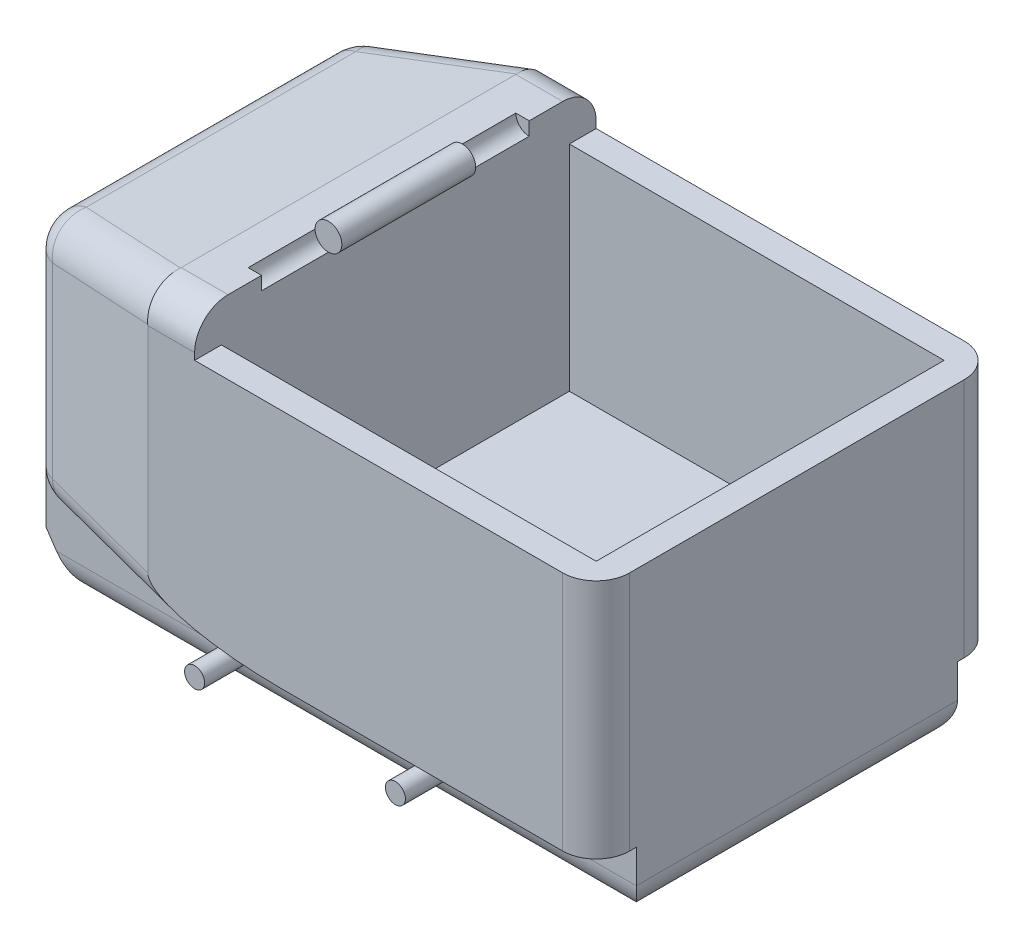
from build123d import *

# Parameters (mm, degrees)
SKETCH1_W                = 900
SKETCH1_H                = 600
BOSS_EXTRUDE1_DEPTH      = 420
SKETCH2_W                = 900
SKETCH2_H                = 480
BOSS_EXTRUDE2_DEPTH      = 100
SKETCH3_W                = 600
SKETCH3_H                = 60
CUT_EXTRUDE1_DEPTH       = 1161.344776349
SKETCH4_W                = 560
SKETCH4_H                = 520
CUT_EXTRUDE2_DEPTH       = 320
CUT_EXTRUDE3_REACH       = 1162.345
CUT_EXTRUDE4_DEPTH       = 1161.344776349
CUT_EXTRUDE6_DEPTH       = 1131.486620885
SKETCH9_R                = 15
BOSS_EXTRUDE3_DEPTH      = 60
BOSS_EXTRUDE4_DEPTH      = 100
BOSS_EXTRUDE4_DEPTH_BACK = 100
SKETCH10_R               = 20
CUT_EXTRUDE7_START       = -100
SKETCH10_2_R             = 20
CUT_EXTRUDE7_DEPTH       = 100
CUT_EXTRUDE8_START       = 200
SKETCH10_3_R             = 20
CUT_EXTRUDE8_DEPTH       = 100
FILLET1_R                = 50
FILLET2_R                = 50
FILLET3_R                = 50


with BuildPart() as part:
    # Sketch1 → Boss-Extrude1 (new body)
    with BuildSketch(Plane(origin=(0, 0, 0), x_dir=(1, 0, 0), z_dir=(0, 1, 0))):
        with Locations((450, 300)):
            Rectangle(SKETCH1_W, SKETCH1_H)
    extrude(amount=BOSS_EXTRUDE1_DEPTH)

    # Sketch2 → Boss-Extrude2 (add)
    with BuildSketch(Plane.XZ):
        with Locations((450, -300)):
            Rectangle(SKETCH2_W, SKETCH2_H)
    extrude(amount=BOSS_EXTRUDE2_DEPTH)

    # Sketch3 → Cut-Extrude1 (cut, through all)
    with BuildSketch(Plane.XY):
        with Locations((600, 390)):
            Rectangle(SKETCH3_W, SKETCH3_H)
    extrude(amount=-CUT_EXTRUDE1_DEPTH, mode=Mode.SUBTRACT)

    # Sketch4 → Cut-Extrude2 (cut)
    with BuildSketch(Plane(origin=(0, 360, 0), x_dir=(1, 0, 0), z_dir=(0, 1, 0))):
        with Locations((580, 300)):
            Rectangle(SKETCH4_W, SKETCH4_H)
    extrude(amount=-CUT_EXTRUDE2_DEPTH, mode=Mode.SUBTRACT)

    # Sketch5 → Cut-Extrude3 (cut, up to next)
    with BuildSketch(Plane.XY, mode=Mode.PRIVATE) as cut_extrude3_sk1:
        Polygon((230, 420), (0, 370), (0, 420), align=None)
    cut_extrude3_tool1 = extrude(cut_extrude3_sk1.sketch, amount=-CUT_EXTRUDE3_REACH, mode=Mode.PRIVATE) & part.part
    add(cut_extrude3_tool1.solids().sort_by_distance((76.666667, 403.333333, 0))[0], mode=Mode.SUBTRACT)

    # Sketch6 → Cut-Extrude4 (cut, through all)
    with BuildSketch(Plane.XZ):
        Polygon((0, -60), (230, 0), (0, 0), align=None)
        Polygon((230, -600), (0, -600), (0, -540), align=None)
    extrude(amount=-CUT_EXTRUDE4_DEPTH, mode=Mode.SUBTRACT)

    # Sketch8 → Cut-Extrude6 (cut, through all)
    with BuildSketch(Plane.XY.offset(-60)):
        Polygon((0, 0), (0, -100), (67, -100), align=None)
    extrude(amount=-CUT_EXTRUDE6_DEPTH, mode=Mode.SUBTRACT)

    # Sketch9 → Boss-Extrude3 (add)
    with BuildSketch(Plane.XY.offset(-60)):
        with Locations(Location((300, -50, 0), (0, 0, 180))):
            Circle(SKETCH9_R)
        with Locations(Location((600, -50, 0), (0, 0, 180))):
            Circle(SKETCH9_R)
    boss_extrude3 = extrude(amount=BOSS_EXTRUDE3_DEPTH)

    # Mirror1: Boss-Extrude3 across plane
    add(boss_extrude3.mirror(Plane.XY.offset(-300)))

    # Sketch10 → Boss-Extrude4 (add, two sides: drawn at the far end of the back side and taken through both)
    with BuildSketch(Plane.XY.offset(-300).offset(-BOSS_EXTRUDE4_DEPTH_BACK)):
        with Locations((300, 420)):
            Circle(SKETCH10_R)
    extrude(amount=BOSS_EXTRUDE4_DEPTH + BOSS_EXTRUDE4_DEPTH_BACK)

    # Sketch10<2> → Cut-Extrude7 (cut)
    with BuildSketch(Plane.XY.offset(-300).offset(CUT_EXTRUDE7_START)):
        with Locations((300, 420)):
            Circle(SKETCH10_2_R)
    extrude(amount=-CUT_EXTRUDE7_DEPTH, mode=Mode.SUBTRACT)

    # Sketch10<3> → Cut-Extrude8 (cut)
    with BuildSketch(Plane.XY.offset(-300).offset(CUT_EXTRUDE8_START)):
        with Locations((300, 420)):
            Circle(SKETCH10_3_R)
    extrude(amount=-CUT_EXTRUDE8_DEPTH, mode=Mode.SUBTRACT)

    # Fillet1
    # the kernel refuses this fillet: 50 mm, written as the material it takes off along each edge
    with BuildSketch(Plane(origin=(50, 329.701729148, -98.629844887), x_dir=(0.6192801017568266, 0.7683705636310696, 0.1615513308930852), z_dir=(-0.7290664199156293, 0.48634721888098287, 0.4815895950268663))) as fillet1_piece_1_section:
        Polygon((-89.929696939, -89.929696939), (89.929696939, -89.929696939), (89.929696939, 89.929696939), (-89.929696939, 89.929696939), align=None)
    fillet1_piece_1 = extrude(amount=89.929696939, mode=Mode.PRIVATE)
    fillet1_piece_1 = split(fillet1_piece_1, bisect_by=Plane(origin=(50, 329.701729148, -98.629844887), z_dir=(0, 1, 0)), keep=Keep.TOP, mode=Mode.PRIVATE)
    fillet1_piece_1 = split(fillet1_piece_1, bisect_by=Plane(origin=(50, 329.701729148, -98.629844887), z_dir=(0, 0, 1)), keep=Keep.TOP, mode=Mode.PRIVATE)
    fillet1_piece_1 = split(fillet1_piece_1, bisect_by=Plane(origin=(50, 329.701729148, -98.629844887), z_dir=(-0.9468950150315111, -0.20584674239815454, -0.24701609087778548)), keep=Keep.TOP, mode=Mode.PRIVATE)
    fillet1_piece_1 = split(fillet1_piece_1, bisect_by=Plane(origin=(37.378905143, 329.701729148, -50.248981267), z_dir=(0.25242189714700275, 0, -0.9676172723968439)), keep=Keep.TOP, mode=Mode.PRIVATE)
    fillet1_piece_1 = split(fillet1_piece_1, bisect_by=Plane(origin=(0, 329.701729148, -98.629844887), z_dir=(1, 0, 0)), keep=Keep.TOP, mode=Mode.PRIVATE)
    fillet1_piece_1 = split(fillet1_piece_1, bisect_by=Plane(origin=(39.378517783, 378.560547344, -98.629844887), z_dir=(0.21242964433104364, -0.9771763639228009, 0)), keep=Keep.TOP, mode=Mode.PRIVATE)
    fillet1_piece_1 = fillet1_piece_1 - Plane(origin=(50, 329.701729148, -98.629844887), x_dir=(0.7290664199156293, -0.48634721888098287, -0.4815895950268663), z_dir=(0.6192801017568266, 0.7683705636310696, 0.1615513308930852)) * Sphere(FILLET1_R, mode=Mode.PRIVATE)
    add(fillet1_piece_1, mode=Mode.SUBTRACT)
    with BuildSketch(Plane(origin=(50, 329.701729148, -501.370155113), x_dir=(-0.6192801017568265, -0.7683705636310695, 0.16155133089308576), z_dir=(-0.7290664199156294, 0.48634721888098265, -0.481589595026866))) as fillet1_piece_2_section:
        Polygon((-89.929696939, -89.929696939), (89.929696939, -89.929696939), (89.929696939, 89.929696939), (-89.929696939, 89.929696939), align=None)
    fillet1_piece_2 = extrude(amount=89.929696939, mode=Mode.PRIVATE)
    fillet1_piece_2 = split(fillet1_piece_2, bisect_by=Plane(origin=(50, 329.701729148, -501.370155113), z_dir=(0, 1, 0)), keep=Keep.TOP, mode=Mode.PRIVATE)
    fillet1_piece_2 = split(fillet1_piece_2, bisect_by=Plane(origin=(50, 329.701729148, -501.370155113), z_dir=(0, 0, -1)), keep=Keep.TOP, mode=Mode.PRIVATE)
    fillet1_piece_2 = split(fillet1_piece_2, bisect_by=Plane(origin=(50, 329.701729148, -501.370155113), z_dir=(-0.9468950150315109, -0.20584674239815448, 0.24701609087778634)), keep=Keep.TOP, mode=Mode.PRIVATE)
    fillet1_piece_2 = split(fillet1_piece_2, bisect_by=Plane(origin=(37.378905143, 329.701729148, -549.751018733), z_dir=(0.25242189714700364, 0, 0.9676172723968437)), keep=Keep.TOP, mode=Mode.PRIVATE)
    fillet1_piece_2 = split(fillet1_piece_2, bisect_by=Plane(origin=(0, 329.701729148, -501.370155113), z_dir=(1, 0, 0)), keep=Keep.TOP, mode=Mode.PRIVATE)
    fillet1_piece_2 = split(fillet1_piece_2, bisect_by=Plane(origin=(39.378517783, 378.560547344, -501.370155113), z_dir=(0.21242964433104364, -0.9771763639228009, 0)), keep=Keep.TOP, mode=Mode.PRIVATE)
    fillet1_piece_2 = fillet1_piece_2 - Plane(origin=(50, 329.701729148, -501.370155113), x_dir=(0.7290664199156294, -0.48634721888098265, 0.481589595026866), z_dir=(-0.6192801017568265, -0.7683705636310695, 0.16155133089308576)) * Sphere(FILLET1_R, mode=Mode.PRIVATE)
    add(fillet1_piece_2, mode=Mode.SUBTRACT)
    with BuildSketch(Plane(origin=(0, 0, -21.995779649), x_dir=(0, 1, 0), z_dir=(0, 0, -1))) as fillet1_piece_3:
        with BuildLine():
            CenterArc((FILLET1_R * 0.304033762809, FILLET1_R), FILLET1_R, 236.177914783, 33.822085217)
            Line((-FILLET1_R * 0.252582122431, FILLET1_R * 0.169230022029), (0, 0))
            Line((0, 0), (FILLET1_R * 0.304033762809, 0))
        make_face()
    extrude(amount=556.008440702, mode=Mode.SUBTRACT)
    with BuildSketch(Plane(origin=(900, -100, -665), x_dir=(-1, 0, 0), z_dir=(0, 0, 1))) as fillet1_piece_4:
        with BuildLine():
            CenterArc((FILLET1_R, -FILLET1_R), FILLET1_R, 90, 90)
            Line((0, -FILLET1_R), (0, 0))
            Line((0, 0), (FILLET1_R, 0))
        make_face()
    extrude(amount=730, mode=Mode.SUBTRACT)
    with BuildSketch(Plane(origin=(1025, -100, -60), x_dir=(0, 0, -1), z_dir=(-1, 0, 0))) as fillet1_piece_5_section:
        with BuildLine():
            CenterArc((FILLET1_R, -FILLET1_R), FILLET1_R, 90, 90)
            Line((0, -FILLET1_R), (0, 0))
            Line((0, 0), (FILLET1_R, 0))
        make_face()
    fillet1_piece_5 = extrude(amount=1083, mode=Mode.PRIVATE)
    fillet1_piece_5 = fillet1_piece_5 - Plane(origin=(600, -50, -60), x_dir=(-1, 0, 0), z_dir=(0, 0, -1)) * Cylinder(15, 2366, mode=Mode.PRIVATE)
    fillet1_piece_5 = fillet1_piece_5 - Plane(origin=(300, -50, -60), x_dir=(-1, 0, 0), z_dir=(0, 0, -1)) * Cylinder(15, 2366, mode=Mode.PRIVATE)
    add(fillet1_piece_5, mode=Mode.SUBTRACT)
    with BuildSketch(Plane(origin=(900, -125, -600), x_dir=(-1, 0, 0), z_dir=(0, 1, 0))) as fillet1_piece_6:
        with BuildLine():
            CenterArc((FILLET1_R, FILLET1_R), FILLET1_R, 180, 90)
            Line((0, FILLET1_R), (0, 0))
            Line((0, 0), (FILLET1_R, 0))
        make_face()
    extrude(amount=610, mode=Mode.SUBTRACT)
    with BuildSketch(Plane(origin=(900, -125, 0), x_dir=(-1, 0, 0), z_dir=(0, 1, 0))) as fillet1_piece_7:
        with BuildLine():
            CenterArc((FILLET1_R, -FILLET1_R), FILLET1_R, 90, 90)
            Line((0, -FILLET1_R), (0, 0))
            Line((0, 0), (FILLET1_R, 0))
        make_face()
    extrude(amount=610, mode=Mode.SUBTRACT)
    with BuildSketch(Plane(origin=(0, 370, -98.629844887), x_dir=(0, -1, 0), z_dir=(0, 0, -1))) as fillet1_piece_8:
        with BuildLine():
            CenterArc((FILLET1_R * 0.805965417038, -FILLET1_R), FILLET1_R, 90, 77.735226272)
            Line((-FILLET1_R * 0.171210946885, -FILLET1_R * 0.787570355669), (0, 0))
            Line((0, 0), (FILLET1_R * 0.805965417038, 0))
        make_face()
    extrude(amount=402.740310226, mode=Mode.SUBTRACT)
    with BuildSketch(Plane(origin=(566.529427721, 493.158571244, -687.790285493), x_dir=(0.19918086341107819, -0.9785842419761663, -0.05196022523767174), z_dir=(-0.9468950150315109, -0.20584674239815448, 0.24701609087778634))) as fillet1_piece_9:
        with BuildLine():
            CenterArc((FILLET1_R * 0.947741611278, FILLET1_R), FILLET1_R, 183.073782419, 86.926217581)
            Line((-FILLET1_R * 0.0508197000604, FILLET1_R * 0.946378106168), (0, 0))
            Line((0, 0), (FILLET1_R * 0.947741611278, 0))
        make_face()
    extrude(amount=568.794970562, mode=Mode.SUBTRACT)
    with BuildSketch(Plane(origin=(566.529427721, 493.158571244, 87.790285493), x_dir=(0.19918086341107794, -0.9785842419761663, 0.05196022523767291), z_dir=(-0.9468950150315111, -0.20584674239815454, -0.24701609087778548))) as fillet1_piece_10:
        with BuildLine():
            CenterArc((FILLET1_R * 0.947741611278, -FILLET1_R), FILLET1_R, 90, 86.926217581)
            Line((-FILLET1_R * 0.0508197000604, -FILLET1_R * 0.946378106168), (0, 0))
            Line((0, 0), (FILLET1_R * 0.947741611278, 0))
        make_face()
    extrude(amount=568.794970562, mode=Mode.SUBTRACT)
    with BuildSketch(Plane(origin=(0, -96.574612217, -60), x_dir=(0.9676172723968437, 0, 0.25242189714700275), z_dir=(0, 1, 0)), Plane(origin=(0, -96.574612217, -540), x_dir=(0, 0, 1), z_dir=(0, 1, 0))) as fillet1_piece_11:
        with BuildLine():
            CenterArc((FILLET1_R * 0.77259689774, FILLET1_R), FILLET1_R, 194.620873989, 75.379126011)
            Line((-FILLET1_R * 0.195020374657, FILLET1_R * 0.747578102853), (0, 0))
            Line((0, 0), (FILLET1_R * 0.77259689774, 0))
        make_face()
    extrude(amount=426.276341366, mode=Mode.SUBTRACT)
    with BuildSketch(Plane(origin=(-58, -100, -540), x_dir=(0, 1, 0), z_dir=(1, 0, 0))) as fillet1_piece_12_section:
        with BuildLine():
            CenterArc((FILLET1_R, FILLET1_R), FILLET1_R, 180, 90)
            Line((0, FILLET1_R), (0, 0))
            Line((0, 0), (FILLET1_R, 0))
        make_face()
    fillet1_piece_12 = extrude(amount=1083, mode=Mode.PRIVATE)
    fillet1_piece_12 = fillet1_piece_12 - Plane(origin=(300, -50, -540), x_dir=(-1, 0, 0), z_dir=(0, 0, 1)) * Cylinder(15, 2366, mode=Mode.PRIVATE)
    fillet1_piece_12 = fillet1_piece_12 - Plane(origin=(600, -50, -540), x_dir=(-1, 0, 0), z_dir=(0, 0, 1)) * Cylinder(15, 2366, mode=Mode.PRIVATE)
    add(fillet1_piece_12, mode=Mode.SUBTRACT)
    with BuildSketch(Plane(origin=(67, -100, 6.712827635), x_dir=(1, 0, 0), z_dir=(0, 0, -1))) as fillet1_piece_13:
        with BuildLine():
            CenterArc((FILLET1_R * 0.533702621082, -FILLET1_R), FILLET1_R, 90, 56.177914783)
            Line((-FILLET1_R * 0.297067356889, -FILLET1_R * 0.443384114759), (0, 0))
            Line((0, 0), (FILLET1_R * 0.533702621082, 0))
        make_face()
    extrude(amount=613.425655271, mode=Mode.SUBTRACT)

    # Fillet2
    # the kernel refuses this fillet: 50 mm, written as the material it takes off along each edge
    with BuildSketch(Plane(origin=(37.378905143, 0, -50.248981267), x_dir=(0.25242189714700275, 0, -0.9676172723968439), z_dir=(0.9676172723968439, 0, 0.25242189714700275))) as fillet2_piece_1_section:
        with BuildLine():
            CenterArc((FILLET2_R, FILLET2_R), FILLET2_R, 180, 90)
            Line((0, FILLET2_R), (0, 0))
            Line((0, 0), (FILLET2_R, 0))
        make_face()
    fillet2_piece_1 = extrude(amount=411.567441593, mode=Mode.PRIVATE)
    fillet2_piece_1 = split(fillet2_piece_1, bisect_by=Plane(origin=(37.378905143, 0, -60), z_dir=(0, 0, 1)), keep=Keep.TOP, mode=Mode.PRIVATE)
    add(fillet2_piece_1, mode=Mode.SUBTRACT)
    with BuildSketch(Plane(origin=(50, 0, -98.629844887), x_dir=(-0.25242189714696206, 0, 0.9676172723968545), z_dir=(0.9676172723968545, 0, 0.25242189714696206))) as fillet2_piece_2_section:
        with BuildLine():
            CenterArc((50 - FILLET2_R, -FILLET2_R), FILLET2_R, 0, 90)
            Line((50, -FILLET2_R), (50, 0))
            Line((50, 0), (50 - FILLET2_R, 0))
        make_face()
    fillet2_piece_2 = revolve(axis=Axis((50, 0, -98.629844887), (0, -1, 0)), revolution_arc=168.035275563, mode=Mode.PRIVATE)
    fillet2_piece_2 = split(fillet2_piece_2, bisect_by=Plane(origin=(50, 0, -60), z_dir=(0, 0, 1)), keep=Keep.TOP, mode=Mode.PRIVATE)
    add(fillet2_piece_2, mode=Mode.SUBTRACT)
    with BuildSketch(Plane(origin=(50, 0, -501.370155113), x_dir=(0.04634195190400165, 0, 0.998925634616375), z_dir=(0.998925634616375, 0, -0.04634195190400165))) as fillet2_piece_3_section:
        with BuildLine():
            CenterArc((50 - FILLET2_R, -FILLET2_R), FILLET2_R, 0, 90)
            Line((50, -FILLET2_R), (50, 0))
            Line((50, 0), (50 - FILLET2_R, 0))
        make_face()
    fillet2_piece_3 = revolve(axis=Axis((50, 0, -501.370155113), (0, -1, 0)), revolution_arc=168.035275563, mode=Mode.PRIVATE)
    fillet2_piece_3 = split(fillet2_piece_3, bisect_by=Plane(origin=(50, 0, -540), z_dir=(0, 0, -1)), keep=Keep.TOP, mode=Mode.PRIVATE)
    add(fillet2_piece_3, mode=Mode.SUBTRACT)
    with BuildSketch(Plane(origin=(37.378905143, 0, -549.751018733), x_dir=(0.25242189714700364, 0, 0.9676172723968436), z_dir=(0.9676172723968437, 0, -0.25242189714700364))) as fillet2_piece_4_section:
        with BuildLine():
            CenterArc((FILLET2_R, -FILLET2_R), FILLET2_R, 90, 90)
            Line((0, -FILLET2_R), (0, 0))
            Line((0, 0), (FILLET2_R, 0))
        make_face()
    fillet2_piece_4 = extrude(amount=411.567441593, mode=Mode.PRIVATE)
    fillet2_piece_4 = split(fillet2_piece_4, bisect_by=Plane(origin=(37.378905143, 0, -540), z_dir=(0, 0, -1)), keep=Keep.TOP, mode=Mode.PRIVATE)
    add(fillet2_piece_4, mode=Mode.SUBTRACT)

    # Fillet3
    fillet3_edges = [part.edges().sort_by_distance(p)[0] for p in [
        (294.537469961, 420, -600),
        (294.537469961, 420, 0),
    ]]
    fillet(fillet3_edges, radius=FILLET3_R)


solid = part.part
